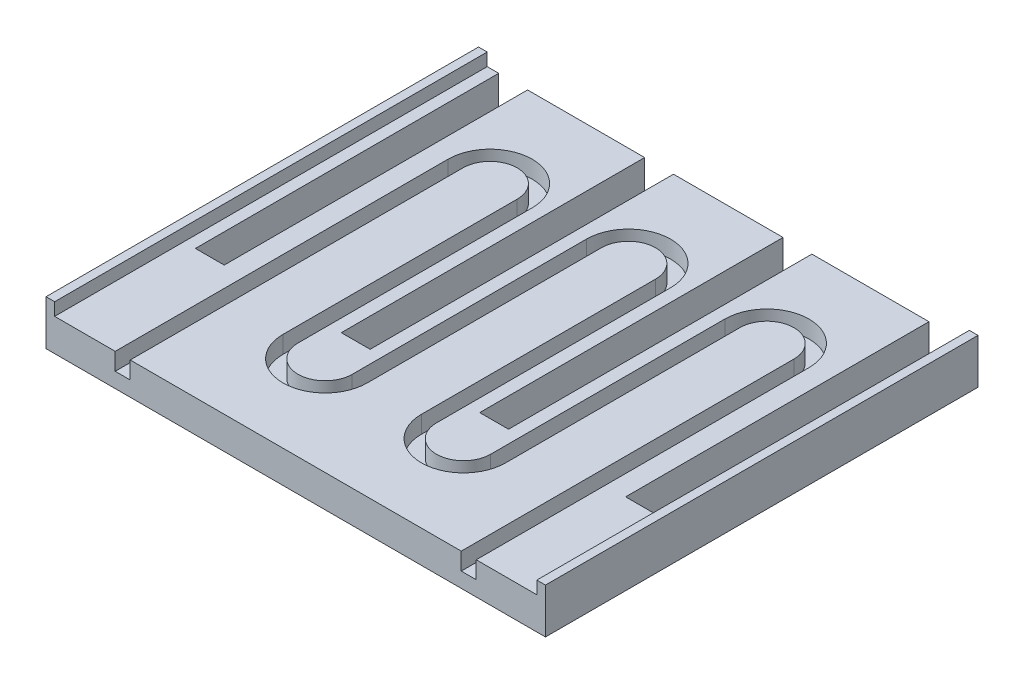
from build123d import *

# Parameters (mm, degrees)
EXTRUDE_4_DEPTH     = 5.6
EXTRUDE_4_2_DEPTH   = 5.6
SKETCH_9_W          = 2.6
SKETCH_9_H          = 12.4
SKETCH_9_H_2        = 50
EXTRUDE_6_DEPTH     = 2.6
DS18B20_W           = 5
DS18B20_H           = 42.5
DS18B20_H_2         = 10.1
CUT_EXTRUDE_1_DEPTH = 5
SKETCH_7_W          = 1.5
SKETCH_7_H          = 75
EXTRUDE_8_DEPTH     = 2.2
FILLET_1_RADIUS     = 4.7
FILLET_1_LENGTH     = 3
FILLET_2_R          = 7.3
FILLET_3_RADIUS     = 4.7
FILLET_3_LENGTH     = 3
FILLET_4_R          = 7.3
FILLET_5_RADIUS     = 4.7
FILLET_5_LENGTH     = 3
FILLET_6_R          = 7.3
FILLET_7_R          = 7.3
FILLET_8_RADIUS     = 4.7
FILLET_8_LENGTH     = 3
FILLET_9_RADIUS     = 4.7
FILLET_9_LENGTH     = 3
FILLET_10_R         = 7.3


with BuildPart() as part:
    # Sketch 2111 → Бобышка-Вытянуть4 (new body)
    with BuildSketch(Plane(origin=(0, 0, 0), x_dir=(1, 0, 0), z_dir=(0, 1, 0))):
        Polygon((14.6, 50), (14.6, 0), (24, 0), (24, 50), (24, 52.6), (38.6, 52.6), (38.6, 50), (38.6, 0), (48, 0), (48, 50), (48, 52.6), (62.6, 52.6), (62.6, 50), (62.6, 0), (62.6, -12.4), (74.6, -12.4), (74.6, 62.6), (-12, 62.6), (-12, -12.4), (0, -12.4), (0, 0), (0, 50), (0, 52.6), (14.6, 52.6), align=None)
    extrude(amount=EXTRUDE_4_DEPTH)



with BuildPart() as body_2:
    # Sketch 2111 → Extrude 4 2 (new body)
    with BuildSketch(Plane(origin=(0, 0, 0), x_dir=(1, 0, 0), z_dir=(0, 1, 0))):
        Polygon((12, -2.6), (12, 0), (12, 50), (2.6, 50), (2.6, 0), (2.6, -12.4), (60, -12.4), (60, 0), (60, 50), (50.6, 50), (50.6, 0), (50.6, -2.6), (36, -2.6), (36, 0), (36, 50), (26.6, 50), (26.6, 0), (26.6, -2.6), align=None)
    extrude(amount=EXTRUDE_4_2_DEPTH)


with BuildPart() as part_1:
    add(part.part)

    add(body_2.part)  # Бобышка-Вытянуть6 merges body 2
    # Подложка трубки<9> → Бобышка-Вытянуть6 (add)
    with BuildSketch(Plane(origin=(0, 0, 0), x_dir=(1, 0, 0), z_dir=(0, 1, 0))):
        with Locations((1.3, -6.2)):
            Rectangle(SKETCH_9_W, SKETCH_9_H)
        with Locations((1.3, 25)):
            Rectangle(SKETCH_9_W, SKETCH_9_H_2)
        Polygon((14.6, 0), (12, 0), (12, -2.6), (26.6, -2.6), (26.6, 0), (24, 0), align=None)
        with Locations((13.3, 25)):
            Rectangle(SKETCH_9_W, SKETCH_9_H_2)
        with Locations((25.3, 25)):
            Rectangle(SKETCH_9_W, SKETCH_9_H_2)
        Polygon((2.6, 50), (12, 50), (14.6, 50), (14.6, 52.6), (0, 52.6), (0, 50), align=None)
        Polygon((24, 52.6), (24, 50), (26.6, 50), (36, 50), (38.6, 50), (38.6, 52.6), align=None)
        with Locations((37.3, 25)):
            Rectangle(SKETCH_9_W, SKETCH_9_H_2)
        Polygon((38.6, 0), (36, 0), (36, -2.6), (50.6, -2.6), (50.6, 0), (48, 0), align=None)
        with Locations((49.3, 25)):
            Rectangle(SKETCH_9_W, SKETCH_9_H_2)
        Polygon((50.6, 50), (60, 50), (62.6, 50), (62.6, 52.6), (48, 52.6), (48, 50), align=None)
        with Locations((61.3, 25)):
            Rectangle(SKETCH_9_W, SKETCH_9_H_2)
        with Locations((61.3, -6.2)):
            Rectangle(SKETCH_9_W, SKETCH_9_H)
    extrude(amount=EXTRUDE_6_DEPTH)

    # DS18B20 → Вырез-Вытянуть1 (cut)
    with BuildSketch(Plane(origin=(0, 5.6, 0), x_dir=(1, 0, 0), z_dir=(0, 1, 0))):
        Polygon((-8.5, 62.6), (-8.5, 17.457748372), (-3.5, 19.012014035), (-3.5, 62.6), align=None)
        Polygon((-3.5, 19.012014035), (-8.5, 17.457748372), (-8.5, 10), (-3.5, 10), align=None)
        with Locations((19.3, 41.35)):
            Rectangle(DS18B20_W, DS18B20_H)
        with Locations((19.3, 15.05)):
            Rectangle(DS18B20_W, DS18B20_H_2)
        with Locations((43.3, 41.35)):
            Rectangle(DS18B20_W, DS18B20_H)
        with Locations((43.3, 15.05)):
            Rectangle(DS18B20_W, DS18B20_H_2)
        with Locations((68.6, 41.35)):
            Rectangle(DS18B20_W, DS18B20_H)
        with Locations((68.6, 15.05)):
            Rectangle(DS18B20_W, DS18B20_H_2)
    extrude(amount=-CUT_EXTRUDE_1_DEPTH, mode=Mode.SUBTRACT)

    # Эскиз7 → Бобышка-Вытянуть8 (add)
    with BuildSketch(Plane(origin=(0, 5.6, 0), x_dir=(1, 0, 0), z_dir=(0, 1, 0))):
        with Locations((-11.25, 25.1)):
            Rectangle(SKETCH_7_W, SKETCH_7_H)
        with Locations((73.85, 25.1)):
            Rectangle(SKETCH_7_W, SKETCH_7_H)
    extrude(amount=EXTRUDE_8_DEPTH)

    # Скругление1: full round fillet: the end face becomes a half cylinder, R = half its width
    fillet_1_face = Plane((55.3, 4.1, -50), x_dir=(0, -1, 0), z_dir=(0, 0, -1))  # on the end face: x along it, z out of the body
    fillet_1_slab = fillet_1_face.offset(-FILLET_1_RADIUS / 2) * Box(FILLET_1_LENGTH, 2 * FILLET_1_RADIUS, FILLET_1_RADIUS, mode=Mode.PRIVATE)  # the body's end, R deep
    fillet_1_round = Plane((55.3, 4.1, -45.3), x_dir=(0, 0, -1), z_dir=(0, -1, 0)) * Cylinder(FILLET_1_RADIUS, FILLET_1_LENGTH, mode=Mode.PRIVATE)  # its axis R under the face
    add(fillet_1_slab - fillet_1_round, mode=Mode.SUBTRACT)

    # Скругление2
    fillet_2_edges = [part_1.edges().sort_by_distance(p)[0] for p in [
        (62.6, 4.1, -52.6),
        (48, 4.1, -52.6),
    ]]
    fillet(fillet_2_edges, radius=FILLET_2_R - 0.0001)  # a hair under: the kernel refuses the full size

    # Скругление3: full round fillet: the end face becomes a half cylinder, R = half its width
    fillet_3_face = Plane((43.3, 4.1, 0), x_dir=(0, 1, 0), z_dir=(0, 0, 1))  # on the end face: x along it, z out of the body
    fillet_3_slab = fillet_3_face.offset(-FILLET_3_RADIUS / 2) * Box(FILLET_3_LENGTH, 2 * FILLET_3_RADIUS, FILLET_3_RADIUS, mode=Mode.PRIVATE)  # the body's end, R deep
    fillet_3_round = Plane((43.3, 4.1, -4.7), x_dir=(0, 0, 1), z_dir=(0, 1, 0)) * Cylinder(FILLET_3_RADIUS, FILLET_3_LENGTH, mode=Mode.PRIVATE)  # its axis R under the face
    add(fillet_3_slab - fillet_3_round, mode=Mode.SUBTRACT)

    # Скругление4
    fillet_4_edges = [part_1.edges().sort_by_distance(p)[0] for p in [
        (50.6, 4.1, 2.6),
        (36, 4.1, 2.6),
    ]]
    fillet(fillet_4_edges, radius=FILLET_4_R - 0.0001)  # a hair under: the kernel refuses the full size

    # Скругление5: full round fillet: the end face becomes a half cylinder, R = half its width
    fillet_5_face = Plane((31.3, 4.1, -50), x_dir=(0, -1, 0), z_dir=(0, 0, -1))  # on the end face: x along it, z out of the body
    fillet_5_slab = fillet_5_face.offset(-FILLET_5_RADIUS / 2) * Box(FILLET_5_LENGTH, 2 * FILLET_5_RADIUS, FILLET_5_RADIUS, mode=Mode.PRIVATE)  # the body's end, R deep
    fillet_5_round = Plane((31.3, 4.1, -45.3), x_dir=(0, 0, -1), z_dir=(0, -1, 0)) * Cylinder(FILLET_5_RADIUS, FILLET_5_LENGTH, mode=Mode.PRIVATE)  # its axis R under the face
    add(fillet_5_slab - fillet_5_round, mode=Mode.SUBTRACT)

    # Скругление6
    fillet_6_edges = [part_1.edges().sort_by_distance(p)[0] for p in [
        (38.6, 4.1, -52.6),
        (24, 4.1, -52.6),
    ]]
    fillet(fillet_6_edges, radius=FILLET_6_R - 0.0001)  # a hair under: the kernel refuses the full size

    # Скругление7
    fillet_7_edges = [part_1.edges().sort_by_distance(p)[0] for p in [
        (26.6, 4.1, 2.6),
        (12, 4.1, 2.6),
    ]]
    fillet(fillet_7_edges, radius=FILLET_7_R - 0.0001)  # a hair under: the kernel refuses the full size

    # Скругление8: full round fillet: the end face becomes a half cylinder, R = half its width
    fillet_8_face = Plane((19.3, 4.1, 0), x_dir=(0, 1, 0), z_dir=(0, 0, 1))  # on the end face: x along it, z out of the body
    fillet_8_slab = fillet_8_face.offset(-FILLET_8_RADIUS / 2) * Box(FILLET_8_LENGTH, 2 * FILLET_8_RADIUS, FILLET_8_RADIUS, mode=Mode.PRIVATE)  # the body's end, R deep
    fillet_8_round = Plane((19.3, 4.1, -4.7), x_dir=(0, 0, 1), z_dir=(0, 1, 0)) * Cylinder(FILLET_8_RADIUS, FILLET_8_LENGTH, mode=Mode.PRIVATE)  # its axis R under the face
    add(fillet_8_slab - fillet_8_round, mode=Mode.SUBTRACT)

    # Скругление9: full round fillet: the end face becomes a half cylinder, R = half its width
    fillet_9_face = Plane((7.3, 4.1, -50), x_dir=(0, 1, 0), z_dir=(0, 0, -1))  # on the end face: x along it, z out of the body
    fillet_9_slab = fillet_9_face.offset(-FILLET_9_RADIUS / 2) * Box(FILLET_9_LENGTH, 2 * FILLET_9_RADIUS, FILLET_9_RADIUS, mode=Mode.PRIVATE)  # the body's end, R deep
    fillet_9_round = Plane((7.3, 4.1, -45.3), x_dir=(0, 0, -1), z_dir=(0, 1, 0)) * Cylinder(FILLET_9_RADIUS, FILLET_9_LENGTH, mode=Mode.PRIVATE)  # its axis R under the face
    add(fillet_9_slab - fillet_9_round, mode=Mode.SUBTRACT)

    # Скругление10
    fillet_10_edges = [part_1.edges().sort_by_distance(p)[0] for p in [
        (14.6, 4.1, -52.6),
        (0, 4.1, -52.6),
    ]]
    fillet(fillet_10_edges, radius=FILLET_10_R - 0.0001)  # a hair under: the kernel refuses the full size


solid = part_1.part
